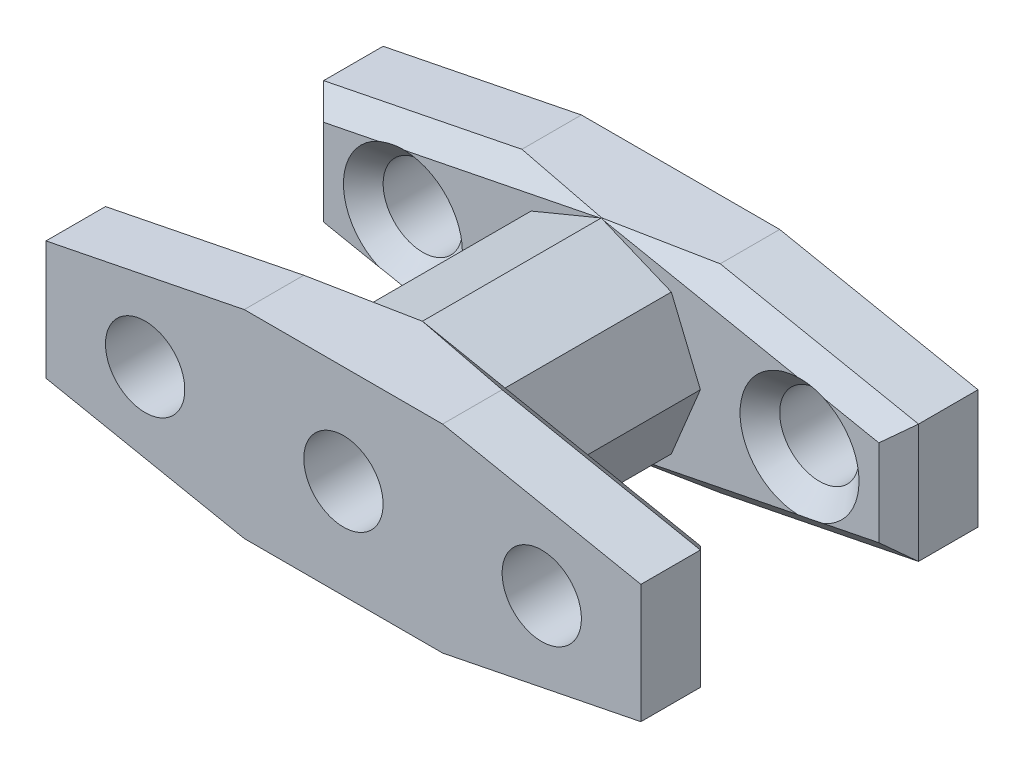
from build123d import *

# Parameters (mm, degrees)
EXTRUDE_1_DEPTH          = 4
EXTRUDE_2_DEPTH          = 9
CHAMFER_1_SIZE           = 1
CHAMFER_2_SIZE           = 1
CHAMFER_3_SIZE           = 1
CHAMFER_4_SIZE           = 1
CUT_EXTRUDE_1_DEPTH      = 24.216373532
CUT_EXTRUDE_1_DEPTH_BACK = 24.216373532
SKETCH_4_R               = 2
CHAMFER_5_SIZE           = 1


with BuildPart() as part:
    # 草图1 → 凸台-拉伸1 (new body)
    with BuildSketch(Plane.XY):
        Polygon((15, -3), (15, 3), (5, 5), (-5, 5), (-15, 3), (-15, -3), (-5, -5), (5, -5), align=None)
    extrude_1 = extrude(amount=EXTRUDE_1_DEPTH)

    # 草图2 → 凸台-拉伸2 (add)
    with BuildSketch(Plane(origin=(0, 0, 0), x_dir=(-1, 0, 0), z_dir=(0, 0, -1))):
        Polygon((0, 5), (-3.535533906, 3.535533906), (-5, 0), (-3.535533906, -3.535533906), (0, -5), (3.535533906, -3.535533906), (5, 0), (3.535533906, 3.535533906), align=None)
    extrude(amount=EXTRUDE_2_DEPTH)

    # 镜向1: 凸台-拉伸1 across plane
    add(extrude_1.mirror(Plane(origin=(0, 0, -4.5), x_dir=(1, 0, 0), z_dir=(0, 0, -1))))

    # 倒角1
    # the kernel refuses this chamfer: 1 mm, written as the material it takes off along each edge
    with BuildSketch(Plane(origin=(-17.521742642, -2.495651472, 0), x_dir=(0.19611613513818427, 0.9805806756909201, 0), z_dir=(0.9805806756909201, -0.19611613513818427, 0))) as chamfer_1_piece_1_section:
        Polygon((CHAMFER_1_SIZE, 0), (0, CHAMFER_1_SIZE), (0, 0), align=None)
    chamfer_1_piece_1 = extrude(amount=20.484770979, mode=Mode.PRIVATE)
    chamfer_1_piece_1 = split(chamfer_1_piece_1, bisect_by=Plane(origin=(-15.841163755, 1.561624871, 0), z_dir=(-0.3826834323650901, -0.9238795325112866, 0)), keep=Keep.TOP, mode=Mode.PRIVATE)
    add(chamfer_1_piece_1, mode=Mode.SUBTRACT)
    with BuildSketch(Plane(origin=(-15, 5.571682988, 0), x_dir=(1, 0, 0), z_dir=(0, -1, 0))) as chamfer_1_piece_2:
        Polygon((CHAMFER_1_SIZE, 0), (0, CHAMFER_1_SIZE), (0, 0), align=None)
    extrude(amount=11.143365976, mode=Mode.SUBTRACT)
    with BuildSketch(Plane(origin=(2.565227926, 6.513045585, 0), x_dir=(0.1961161351381843, -0.9805806756909201, 0), z_dir=(-0.9805806756909201, -0.19611613513818427, 0))) as chamfer_1_piece_3_section:
        Polygon((CHAMFER_1_SIZE, 0), (0, CHAMFER_1_SIZE), (0, 0), align=None)
    chamfer_1_piece_3 = extrude(amount=20.484770979, mode=Mode.PRIVATE)
    chamfer_1_piece_3 = split(chamfer_1_piece_3, bisect_by=Plane(origin=(2.724501391, 6.128525427, 0), z_dir=(-0.38268343236508795, 0.9238795325112875, 0)), keep=Keep.TOP, mode=Mode.PRIVATE)
    add(chamfer_1_piece_3, mode=Mode.SUBTRACT)

    # 倒角2
    # the kernel refuses this chamfer: 1 mm, written as the material it takes off along each edge
    with BuildSketch(Plane(origin=(-2.565227926, -6.513045585, 0), x_dir=(-0.1961161351381843, 0.9805806756909202, 0), z_dir=(0.9805806756909201, 0.19611613513818427, 0))) as chamfer_2_piece_1_section:
        Polygon((CHAMFER_2_SIZE, 0), (0, CHAMFER_2_SIZE), (0, 0), align=None)
    chamfer_2_piece_1 = extrude(amount=20.484770979, mode=Mode.PRIVATE)
    chamfer_2_piece_1 = split(chamfer_2_piece_1, bisect_by=Plane(origin=(-2.724501391, -6.128525427, 0), z_dir=(0.3826834323650899, -0.9238795325112867, 0)), keep=Keep.TOP, mode=Mode.PRIVATE)
    add(chamfer_2_piece_1, mode=Mode.SUBTRACT)
    with BuildSketch(Plane(origin=(15, -5.571682988, 0), x_dir=(-1, 0, 0), z_dir=(0, 1, 0))) as chamfer_2_piece_2:
        Polygon((CHAMFER_2_SIZE, 0), (0, CHAMFER_2_SIZE), (0, 0), align=None)
    extrude(amount=11.143365976, mode=Mode.SUBTRACT)
    with BuildSketch(Plane(origin=(17.521742642, 2.495651472, 0), x_dir=(-0.19611613513818427, -0.9805806756909201, 0), z_dir=(-0.9805806756909201, 0.19611613513818427, 0))) as chamfer_2_piece_3_section:
        Polygon((CHAMFER_2_SIZE, 0), (0, CHAMFER_2_SIZE), (0, 0), align=None)
    chamfer_2_piece_3 = extrude(amount=20.484770979, mode=Mode.PRIVATE)
    chamfer_2_piece_3 = split(chamfer_2_piece_3, bisect_by=Plane(origin=(15.841163755, -1.561624871, 0), z_dir=(0.38268343236509167, 0.923879532511286, 0)), keep=Keep.TOP, mode=Mode.PRIVATE)
    add(chamfer_2_piece_3, mode=Mode.SUBTRACT)

    # 倒角3
    # the kernel refuses this chamfer: 1 mm, written as the material it takes off along each edge
    with BuildSketch(Plane(origin=(-17.521742642, -2.495651472, -9), x_dir=(0.19611613513818427, 0.9805806756909201, 0), z_dir=(0.9805806756909201, -0.19611613513818427, 0))) as chamfer_3_piece_1_section:
        Polygon((CHAMFER_3_SIZE, 0), (0, -CHAMFER_3_SIZE), (0, 0), align=None)
    chamfer_3_piece_1 = extrude(amount=20.484770979, mode=Mode.PRIVATE)
    chamfer_3_piece_1 = split(chamfer_3_piece_1, bisect_by=Plane(origin=(-15.841163755, 1.561624871, -9), z_dir=(-0.3826834323650901, -0.9238795325112866, 0)), keep=Keep.TOP, mode=Mode.PRIVATE)
    add(chamfer_3_piece_1, mode=Mode.SUBTRACT)
    with BuildSketch(Plane(origin=(-15, 5.571682988, -9), x_dir=(1, 0, 0), z_dir=(0, -1, 0))) as chamfer_3_piece_2:
        Polygon((CHAMFER_3_SIZE, 0), (0, -CHAMFER_3_SIZE), (0, 0), align=None)
    extrude(amount=11.143365976, mode=Mode.SUBTRACT)
    with BuildSketch(Plane(origin=(2.565227926, 6.513045585, -9), x_dir=(0.1961161351381843, -0.9805806756909202, 0), z_dir=(-0.9805806756909201, -0.19611613513818427, 0))) as chamfer_3_piece_3_section:
        Polygon((CHAMFER_3_SIZE, 0), (0, -CHAMFER_3_SIZE), (0, 0), align=None)
    chamfer_3_piece_3 = extrude(amount=20.484770979, mode=Mode.PRIVATE)
    chamfer_3_piece_3 = split(chamfer_3_piece_3, bisect_by=Plane(origin=(2.724501391, 6.128525427, -9), z_dir=(-0.38268343236508795, 0.9238795325112875, 0)), keep=Keep.TOP, mode=Mode.PRIVATE)
    add(chamfer_3_piece_3, mode=Mode.SUBTRACT)

    # 倒角4
    # the kernel refuses this chamfer: 1 mm, written as the material it takes off along each edge
    with BuildSketch(Plane(origin=(-2.565227926, -6.513045585, -9), x_dir=(0, 0, -1), z_dir=(0.9805806756909201, 0.19611613513818427, 0))) as chamfer_4_piece_1_section:
        Polygon((CHAMFER_4_SIZE, 0), (0, CHAMFER_4_SIZE), (0, 0), align=None)
    chamfer_4_piece_1 = extrude(amount=20.484770979, mode=Mode.PRIVATE)
    chamfer_4_piece_1 = split(chamfer_4_piece_1, bisect_by=Plane(origin=(-2.724501391, -6.128525427, -9), z_dir=(0.3826834323650899, -0.9238795325112867, 0)), keep=Keep.TOP, mode=Mode.PRIVATE)
    add(chamfer_4_piece_1, mode=Mode.SUBTRACT)
    with BuildSketch(Plane(origin=(15, -5.571682988, -9), x_dir=(0, 0, -1), z_dir=(0, 1, 0))) as chamfer_4_piece_2:
        Polygon((CHAMFER_4_SIZE, 0), (0, CHAMFER_4_SIZE), (0, 0), align=None)
    extrude(amount=11.143365976, mode=Mode.SUBTRACT)
    with BuildSketch(Plane(origin=(17.521742642, 2.495651472, -9), x_dir=(0, 0, -1), z_dir=(-0.9805806756909201, 0.19611613513818427, 0))) as chamfer_4_piece_3_section:
        Polygon((CHAMFER_4_SIZE, 0), (0, CHAMFER_4_SIZE), (0, 0), align=None)
    chamfer_4_piece_3 = extrude(amount=20.484770979, mode=Mode.PRIVATE)
    chamfer_4_piece_3 = split(chamfer_4_piece_3, bisect_by=Plane(origin=(15.841163755, -1.561624871, -9), z_dir=(0.38268343236509167, 0.923879532511286, 0)), keep=Keep.TOP, mode=Mode.PRIVATE)
    add(chamfer_4_piece_3, mode=Mode.SUBTRACT)

    # 草图4 → 切除-拉伸1 (cut, two sides: drawn at the far end of the back side and taken through both)
    with BuildSketch(Plane(origin=(0, 0, -13), x_dir=(-1, 0, 0), z_dir=(0, 0, -1)).offset(-CUT_EXTRUDE_1_DEPTH_BACK)):
        Circle(SKETCH_4_R)
        with Locations((10, 0)):
            Circle(SKETCH_4_R)
        with Locations(Location((-10, 0, 0), (0, 0, 180))):
            Circle(SKETCH_4_R)
    extrude(amount=CUT_EXTRUDE_1_DEPTH + CUT_EXTRUDE_1_DEPTH_BACK, mode=Mode.SUBTRACT)

    # 倒角5
    # the kernel refuses this chamfer: 1 mm, written as the material it takes off along each edge
    with BuildSketch(Plane(origin=(10, 0, 0), x_dir=(1, 0, 0), z_dir=(0, 1, 0))) as chamfer_5_piece_1:
        Polygon((2 + CHAMFER_5_SIZE, 0), (2, -CHAMFER_5_SIZE), (2, 0), align=None)
    revolve(axis=Axis((10, 0, 0), (0, 0, -1)), mode=Mode.SUBTRACT)
    with BuildSketch(Plane(origin=(10, 0, -9), x_dir=(1, 0, 0), z_dir=(0, 1, 0))) as chamfer_5_piece_2:
        Polygon((2 + CHAMFER_5_SIZE, 0), (2, CHAMFER_5_SIZE), (2, 0), align=None)
    revolve(axis=Axis((10, 0, -9), (0, 0, -1)), mode=Mode.SUBTRACT)
    with BuildSketch(Plane(origin=(-10, 0, -9), x_dir=(-1, 0, 0), z_dir=(0, -1, 0))) as chamfer_5_piece_3:
        Polygon((2, CHAMFER_5_SIZE), (2 + CHAMFER_5_SIZE, 0), (2, 0), align=None)
    revolve(axis=Axis((-10, 0, -9), (0, 0, -1)), mode=Mode.SUBTRACT)
    with BuildSketch(Plane(origin=(-10, 0, 0), x_dir=(-1, 0, 0), z_dir=(0, -1, 0))) as chamfer_5_piece_4:
        Polygon((2, -CHAMFER_5_SIZE), (2 + CHAMFER_5_SIZE, 0), (2, 0), align=None)
    revolve(axis=Axis((-10, 0, 0), (0, 0, -1)), mode=Mode.SUBTRACT)


solid = part.part
